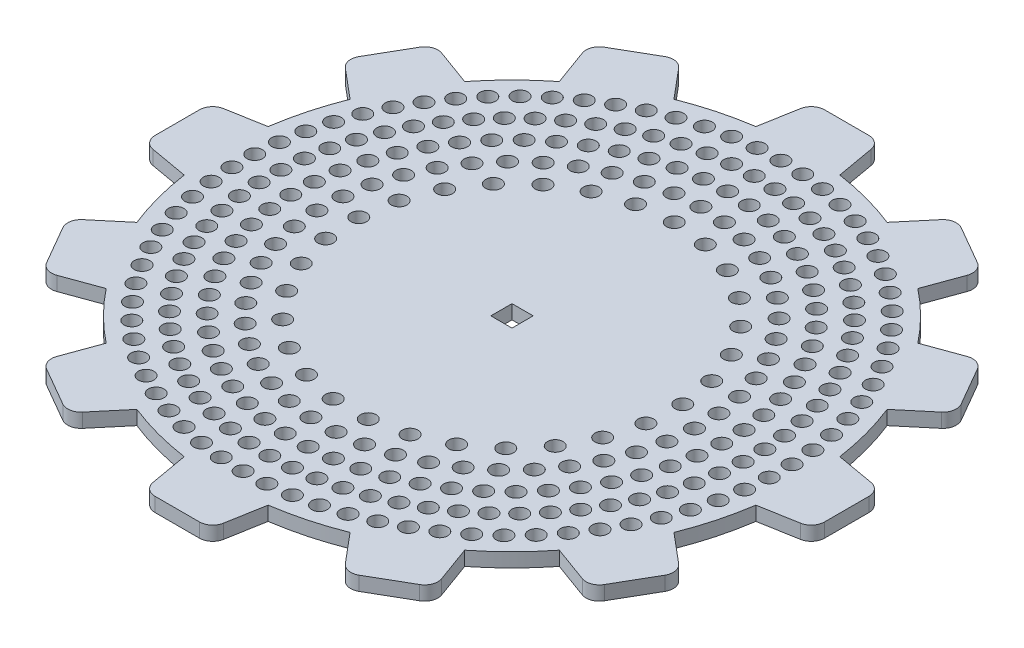
from build123d import *

# Parameters (mm, degrees)
SKETCH1_R           = 130
SKETCH1_R_2         = 3.5
SKETCH1_W           = 9.525
SKETCH1_H           = 9.525
BOSS_EXTRUDE1_DEPTH = 6.35
BOSS_EXTRUDE2_START = -6.35
BOSS_EXTRUDE2_DEPTH = 6.35
FILLET3_R           = 6
FILLET4_R           = 6


with BuildPart() as part:
    # Sketch1 → Boss-Extrude1 (new body)
    with BuildSketch(Plane(origin=(0, 0, 0), x_dir=(1, 0, 0), z_dir=(0, 1, 0))):
        with Locations(Location((0, 0, 0), (0, 0, 270))):
            Circle(SKETCH1_R)
        with Locations(Location((0, 85, 0), (0, 0, 270))):
            Circle(SKETCH1_R_2, mode=Mode.SUBTRACT)
        with Locations(Location((0, 97, 0), (0, 0, 270))):
            Circle(SKETCH1_R_2, mode=Mode.SUBTRACT)
        with Locations(Location((0, 109, 0), (0, 0, 270))):
            Circle(SKETCH1_R_2, mode=Mode.SUBTRACT)
        with Locations(Location((0, 121, 0), (0, 0, 270))):
            Circle(SKETCH1_R_2, mode=Mode.SUBTRACT)
        with Locations(Location((10.261516862, 120.564096114, 0), (0, 0, 270))):
            Circle(SKETCH1_R_2, mode=Mode.SUBTRACT)
        with Locations(Location((20.449099259, 119.259525152, 0), (0, 0, 270))):
            Circle(SKETCH1_R_2, mode=Mode.SUBTRACT)
        with Locations(Location((30.489345428, 117.095686579, 0), (0, 0, 270))):
            Circle(SKETCH1_R_2, mode=Mode.SUBTRACT)
        with Locations(Location((40.309915164, 114.088170901, 0), (0, 0, 270))):
            Circle(SKETCH1_R_2, mode=Mode.SUBTRACT)
        with Locations(Location((49.840051038, 110.258647337, 0), (0, 0, 270))):
            Circle(SKETCH1_R_2, mode=Mode.SUBTRACT)
        with Locations(Location((59.011088201, 105.634707693, 0), (0, 0, 270))):
            Circle(SKETCH1_R_2, mode=Mode.SUBTRACT)
        with Locations(Location((67.756949123, 100.249667559, 0), (0, 0, 270))):
            Circle(SKETCH1_R_2, mode=Mode.SUBTRACT)
        with Locations(Location((76.014619673, 94.142326273, 0), (0, 0, 270))):
            Circle(SKETCH1_R_2, mode=Mode.SUBTRACT)
        with Locations(Location((83.724603146, 87.356687369, 0), (0, 0, 270))):
            Circle(SKETCH1_R_2, mode=Mode.SUBTRACT)
        with Locations(Location((90.831348936, 79.94164153, 0), (0, 0, 270))):
            Circle(SKETCH1_R_2, mode=Mode.SUBTRACT)
        with Locations(Location((97.283652774, 71.950614333, 0), (0, 0, 270))):
            Circle(SKETCH1_R_2, mode=Mode.SUBTRACT)
        with Locations(Location((103.035025666, 63.44118131, 0), (0, 0, 270))):
            Circle(SKETCH1_R_2, mode=Mode.SUBTRACT)
        with Locations(Location((108.044028836, 54.474653123, 0), (0, 0, 270))):
            Circle(SKETCH1_R_2, mode=Mode.SUBTRACT)
        with Locations(Location((112.274572303, 45.115633811, 0), (0, 0, 270))):
            Circle(SKETCH1_R_2, mode=Mode.SUBTRACT)
        with Locations(Location((115.696174903, 35.431555324, 0), (0, 0, 270))):
            Circle(SKETCH1_R_2, mode=Mode.SUBTRACT)
        with Locations(Location((118.284183913, 25.492191669, 0), (0, 0, 270))):
            Circle(SKETCH1_R_2, mode=Mode.SUBTRACT)
        with Locations(Location((120.019952666, 15.369156189, 0), (0, 0, 270))):
            Circle(SKETCH1_R_2, mode=Mode.SUBTRACT)
        with Locations(Location((120.890974911, 5.135385587, 0), (0, 0, 270))):
            Circle(SKETCH1_R_2, mode=Mode.SUBTRACT)
        with Locations(Location((120.890974911, -5.135385587, 0), (0, 0, 270))):
            Circle(SKETCH1_R_2, mode=Mode.SUBTRACT)
        with Locations(Location((120.019952666, -15.369156189, 0), (0, 0, 270))):
            Circle(SKETCH1_R_2, mode=Mode.SUBTRACT)
        with Locations(Location((118.284183913, -25.492191669, 0), (0, 0, 270))):
            Circle(SKETCH1_R_2, mode=Mode.SUBTRACT)
        with Locations(Location((115.696174903, -35.431555324, 0), (0, 0, 270))):
            Circle(SKETCH1_R_2, mode=Mode.SUBTRACT)
        with Locations(Location((112.274572303, -45.115633811, 0), (0, 0, 270))):
            Circle(SKETCH1_R_2, mode=Mode.SUBTRACT)
        with Locations(Location((108.044028836, -54.474653123, 0), (0, 0, 270))):
            Circle(SKETCH1_R_2, mode=Mode.SUBTRACT)
        with Locations(Location((103.035025666, -63.44118131, 0), (0, 0, 270))):
            Circle(SKETCH1_R_2, mode=Mode.SUBTRACT)
        with Locations(Location((97.283652774, -71.950614333, 0), (0, 0, 270))):
            Circle(SKETCH1_R_2, mode=Mode.SUBTRACT)
        with Locations(Location((90.831348936, -79.94164153, 0), (0, 0, 270))):
            Circle(SKETCH1_R_2, mode=Mode.SUBTRACT)
        with Locations(Location((83.724603146, -87.356687368, 0), (0, 0, 270))):
            Circle(SKETCH1_R_2, mode=Mode.SUBTRACT)
        with Locations(Location((76.014619673, -94.142326273, 0), (0, 0, 270))):
            Circle(SKETCH1_R_2, mode=Mode.SUBTRACT)
        with Locations(Location((67.756949123, -100.249667558, 0), (0, 0, 270))):
            Circle(SKETCH1_R_2, mode=Mode.SUBTRACT)
        with Locations(Location((59.011088201, -105.634707692, 0), (0, 0, 270))):
            Circle(SKETCH1_R_2, mode=Mode.SUBTRACT)
        with Locations(Location((49.840051038, -110.258647337, 0), (0, 0, 270))):
            Circle(SKETCH1_R_2, mode=Mode.SUBTRACT)
        with Locations(Location((40.309915164, -114.088170901, 0), (0, 0, 270))):
            Circle(SKETCH1_R_2, mode=Mode.SUBTRACT)
        with Locations(Location((30.489345428, -117.095686579, 0), (0, 0, 270))):
            Circle(SKETCH1_R_2, mode=Mode.SUBTRACT)
        with Locations(Location((20.449099259, -119.259525152, 0), (0, 0, 270))):
            Circle(SKETCH1_R_2, mode=Mode.SUBTRACT)
        with Locations(Location((10.261516862, -120.564096114, 0), (0, 0, 270))):
            Circle(SKETCH1_R_2, mode=Mode.SUBTRACT)
        with Locations(Location((0, -121, 0), (0, 0, 270))):
            Circle(SKETCH1_R_2, mode=Mode.SUBTRACT)
        with Locations(Location((-10.261516862, -120.564096114, 0), (0, 0, 270))):
            Circle(SKETCH1_R_2, mode=Mode.SUBTRACT)
        with Locations(Location((-20.449099259, -119.259525152, 0), (0, 0, 270))):
            Circle(SKETCH1_R_2, mode=Mode.SUBTRACT)
        with Locations(Location((-30.489345428, -117.095686579, 0), (0, 0, 270))):
            Circle(SKETCH1_R_2, mode=Mode.SUBTRACT)
        with Locations(Location((-40.309915164, -114.088170901, 0), (0, 0, 270))):
            Circle(SKETCH1_R_2, mode=Mode.SUBTRACT)
        with Locations(Location((-49.840051038, -110.258647337, 0), (0, 0, 270))):
            Circle(SKETCH1_R_2, mode=Mode.SUBTRACT)
        with Locations(Location((-59.011088201, -105.634707693, 0), (0, 0, 270))):
            Circle(SKETCH1_R_2, mode=Mode.SUBTRACT)
        with Locations(Location((-67.756949123, -100.249667559, 0), (0, 0, 270))):
            Circle(SKETCH1_R_2, mode=Mode.SUBTRACT)
        with Locations(Location((-76.014619673, -94.142326273, 0), (0, 0, 270))):
            Circle(SKETCH1_R_2, mode=Mode.SUBTRACT)
        with Locations(Location((-83.724603146, -87.356687369, 0), (0, 0, 270))):
            Circle(SKETCH1_R_2, mode=Mode.SUBTRACT)
        with Locations(Location((-90.831348936, -79.94164153, 0), (0, 0, 270))):
            Circle(SKETCH1_R_2, mode=Mode.SUBTRACT)
        with Locations(Location((-97.283652774, -71.950614333, 0), (0, 0, 270))):
            Circle(SKETCH1_R_2, mode=Mode.SUBTRACT)
        with Locations(Location((-103.035025666, -63.44118131, 0), (0, 0, 270))):
            Circle(SKETCH1_R_2, mode=Mode.SUBTRACT)
        with Locations(Location((-108.044028836, -54.474653123, 0), (0, 0, 270))):
            Circle(SKETCH1_R_2, mode=Mode.SUBTRACT)
        with Locations(Location((-112.274572303, -45.115633811, 0), (0, 0, 270))):
            Circle(SKETCH1_R_2, mode=Mode.SUBTRACT)
        with Locations(Location((-115.696174903, -35.431555324, 0), (0, 0, 270))):
            Circle(SKETCH1_R_2, mode=Mode.SUBTRACT)
        with Locations(Location((-118.284183913, -25.492191669, 0), (0, 0, 270))):
            Circle(SKETCH1_R_2, mode=Mode.SUBTRACT)
        with Locations(Location((-120.019952666, -15.369156189, 0), (0, 0, 270))):
            Circle(SKETCH1_R_2, mode=Mode.SUBTRACT)
        with Locations(Location((-120.890974911, -5.135385587, 0), (0, 0, 270))):
            Circle(SKETCH1_R_2, mode=Mode.SUBTRACT)
        with Locations(Location((-120.890974911, 5.135385587, 0), (0, 0, 270))):
            Circle(SKETCH1_R_2, mode=Mode.SUBTRACT)
        with Locations(Location((-120.019952666, 15.369156189, 0), (0, 0, 270))):
            Circle(SKETCH1_R_2, mode=Mode.SUBTRACT)
        with Locations(Location((-118.284183913, 25.492191669, 0), (0, 0, 270))):
            Circle(SKETCH1_R_2, mode=Mode.SUBTRACT)
        with Locations(Location((-115.696174903, 35.431555324, 0), (0, 0, 270))):
            Circle(SKETCH1_R_2, mode=Mode.SUBTRACT)
        with Locations(Location((-112.274572303, 45.115633811, 0), (0, 0, 270))):
            Circle(SKETCH1_R_2, mode=Mode.SUBTRACT)
        with Locations(Location((-108.044028836, 54.474653123, 0), (0, 0, 270))):
            Circle(SKETCH1_R_2, mode=Mode.SUBTRACT)
        with Locations(Location((-103.035025666, 63.44118131, 0), (0, 0, 270))):
            Circle(SKETCH1_R_2, mode=Mode.SUBTRACT)
        with Locations(Location((-97.283652774, 71.950614333, 0), (0, 0, 270))):
            Circle(SKETCH1_R_2, mode=Mode.SUBTRACT)
        with Locations(Location((-90.831348936, 79.94164153, 0), (0, 0, 270))):
            Circle(SKETCH1_R_2, mode=Mode.SUBTRACT)
        with Locations(Location((-83.724603146, 87.356687368, 0), (0, 0, 270))):
            Circle(SKETCH1_R_2, mode=Mode.SUBTRACT)
        with Locations(Location((9.77068467, 108.561198045, 0), (0, 0, 270))):
            Circle(SKETCH1_R_2, mode=Mode.SUBTRACT)
        with Locations(Location((19.462701533, 107.248325157, 0), (0, 0, 270))):
            Circle(SKETCH1_R_2, mode=Mode.SUBTRACT)
        with Locations(Location((28.998016167, 105.071951816, 0), (0, 0, 270))):
            Circle(SKETCH1_R_2, mode=Mode.SUBTRACT)
        with Locations(Location((38.299855825, 102.0496009, 0), (0, 0, 270))):
            Circle(SKETCH1_R_2, mode=Mode.SUBTRACT)
        with Locations(Location((47.293327564, 98.205606601, 0), (0, 0, 270))):
            Circle(SKETCH1_R_2, mode=Mode.SUBTRACT)
        with Locations(Location((55.906021237, 93.570918503, 0), (0, 0, 270))):
            Circle(SKETCH1_R_2, mode=Mode.SUBTRACT)
        with Locations(Location((64.0685925, 88.182852387, 0), (0, 0, 270))):
            Circle(SKETCH1_R_2, mode=Mode.SUBTRACT)
        with Locations(Location((71.715321127, 82.084789794, 0), (0, 0, 270))):
            Circle(SKETCH1_R_2, mode=Mode.SUBTRACT)
        with Locations(Location((78.784640157, 75.32582874, 0), (0, 0, 270))):
            Circle(SKETCH1_R_2, mode=Mode.SUBTRACT)
        with Locations(Location((85.219631589, 67.960388403, 0), (0, 0, 270))):
            Circle(SKETCH1_R_2, mode=Mode.SUBTRACT)
        with Locations(Location((90.968484656, 60.047770978, 0), (0, 0, 270))):
            Circle(SKETCH1_R_2, mode=Mode.SUBTRACT)
        with Locations(Location((95.984912972, 51.65168421, 0), (0, 0, 270))):
            Circle(SKETCH1_R_2, mode=Mode.SUBTRACT)
        with Locations(Location((100.228527208, 42.83972845, 0), (0, 0, 270))):
            Circle(SKETCH1_R_2, mode=Mode.SUBTRACT)
        with Locations(Location((103.665160276, 33.682852387, 0), (0, 0, 270))):
            Circle(SKETCH1_R_2, mode=Mode.SUBTRACT)
        with Locations(Location((106.267142428, 24.254781801, 0), (0, 0, 270))):
            Circle(SKETCH1_R_2, mode=Mode.SUBTRACT)
        with Locations(Location((108.013524033, 14.631425974, 0), (0, 0, 270))):
            Circle(SKETCH1_R_2, mode=Mode.SUBTRACT)
        with Locations(Location((108.890244253, 4.890266508, 0), (0, 0, 270))):
            Circle(SKETCH1_R_2, mode=Mode.SUBTRACT)
        with Locations(Location((108.890244253, -4.890266508, 0), (0, 0, 270))):
            Circle(SKETCH1_R_2, mode=Mode.SUBTRACT)
        with Locations(Location((108.013524033, -14.631425974, 0), (0, 0, 270))):
            Circle(SKETCH1_R_2, mode=Mode.SUBTRACT)
        with Locations(Location((106.267142428, -24.254781801, 0), (0, 0, 270))):
            Circle(SKETCH1_R_2, mode=Mode.SUBTRACT)
        with Locations(Location((103.665160276, -33.682852387, 0), (0, 0, 270))):
            Circle(SKETCH1_R_2, mode=Mode.SUBTRACT)
        with Locations(Location((100.228527208, -42.83972845, 0), (0, 0, 270))):
            Circle(SKETCH1_R_2, mode=Mode.SUBTRACT)
        with Locations(Location((95.984912972, -51.65168421, 0), (0, 0, 270))):
            Circle(SKETCH1_R_2, mode=Mode.SUBTRACT)
        with Locations(Location((90.968484656, -60.047770978, 0), (0, 0, 270))):
            Circle(SKETCH1_R_2, mode=Mode.SUBTRACT)
        with Locations(Location((85.219631589, -67.960388403, 0), (0, 0, 270))):
            Circle(SKETCH1_R_2, mode=Mode.SUBTRACT)
        with Locations(Location((78.784640157, -75.32582874, 0), (0, 0, 270))):
            Circle(SKETCH1_R_2, mode=Mode.SUBTRACT)
        with Locations(Location((71.715321127, -82.084789794, 0), (0, 0, 270))):
            Circle(SKETCH1_R_2, mode=Mode.SUBTRACT)
        with Locations(Location((64.0685925, -88.182852387, 0), (0, 0, 270))):
            Circle(SKETCH1_R_2, mode=Mode.SUBTRACT)
        with Locations(Location((55.906021237, -93.570918503, 0), (0, 0, 270))):
            Circle(SKETCH1_R_2, mode=Mode.SUBTRACT)
        with Locations(Location((47.293327564, -98.205606601, 0), (0, 0, 270))):
            Circle(SKETCH1_R_2, mode=Mode.SUBTRACT)
        with Locations(Location((38.299855825, -102.0496009, 0), (0, 0, 270))):
            Circle(SKETCH1_R_2, mode=Mode.SUBTRACT)
        with Locations(Location((28.998016167, -105.071951816, 0), (0, 0, 270))):
            Circle(SKETCH1_R_2, mode=Mode.SUBTRACT)
        with Locations(Location((19.462701533, -107.248325157, 0), (0, 0, 270))):
            Circle(SKETCH1_R_2, mode=Mode.SUBTRACT)
        with Locations(Location((9.77068467, -108.561198045, 0), (0, 0, 270))):
            Circle(SKETCH1_R_2, mode=Mode.SUBTRACT)
        with Locations(Location((0, -109, 0), (0, 0, 270))):
            Circle(SKETCH1_R_2, mode=Mode.SUBTRACT)
        with Locations(Location((-9.77068467, -108.561198045, 0), (0, 0, 270))):
            Circle(SKETCH1_R_2, mode=Mode.SUBTRACT)
        with Locations(Location((-19.462701533, -107.248325157, 0), (0, 0, 270))):
            Circle(SKETCH1_R_2, mode=Mode.SUBTRACT)
        with Locations(Location((-28.998016167, -105.071951816, 0), (0, 0, 270))):
            Circle(SKETCH1_R_2, mode=Mode.SUBTRACT)
        with Locations(Location((-38.299855825, -102.0496009, 0), (0, 0, 270))):
            Circle(SKETCH1_R_2, mode=Mode.SUBTRACT)
        with Locations(Location((-47.293327564, -98.205606601, 0), (0, 0, 270))):
            Circle(SKETCH1_R_2, mode=Mode.SUBTRACT)
        with Locations(Location((-55.906021237, -93.570918503, 0), (0, 0, 270))):
            Circle(SKETCH1_R_2, mode=Mode.SUBTRACT)
        with Locations(Location((-64.0685925, -88.182852387, 0), (0, 0, 270))):
            Circle(SKETCH1_R_2, mode=Mode.SUBTRACT)
        with Locations(Location((-71.715321127, -82.084789794, 0), (0, 0, 270))):
            Circle(SKETCH1_R_2, mode=Mode.SUBTRACT)
        with Locations(Location((-78.784640157, -75.32582874, 0), (0, 0, 270))):
            Circle(SKETCH1_R_2, mode=Mode.SUBTRACT)
        with Locations(Location((-85.219631589, -67.960388403, 0), (0, 0, 270))):
            Circle(SKETCH1_R_2, mode=Mode.SUBTRACT)
        with Locations(Location((-90.968484656, -60.047770978, 0), (0, 0, 270))):
            Circle(SKETCH1_R_2, mode=Mode.SUBTRACT)
        with Locations(Location((-95.984912972, -51.65168421, 0), (0, 0, 270))):
            Circle(SKETCH1_R_2, mode=Mode.SUBTRACT)
        with Locations(Location((-100.228527208, -42.83972845, 0), (0, 0, 270))):
            Circle(SKETCH1_R_2, mode=Mode.SUBTRACT)
        with Locations(Location((-103.665160276, -33.682852387, 0), (0, 0, 270))):
            Circle(SKETCH1_R_2, mode=Mode.SUBTRACT)
        with Locations(Location((-106.267142428, -24.254781801, 0), (0, 0, 270))):
            Circle(SKETCH1_R_2, mode=Mode.SUBTRACT)
        with Locations(Location((-108.013524033, -14.631425974, 0), (0, 0, 270))):
            Circle(SKETCH1_R_2, mode=Mode.SUBTRACT)
        with Locations(Location((-108.890244253, -4.890266508, 0), (0, 0, 270))):
            Circle(SKETCH1_R_2, mode=Mode.SUBTRACT)
        with Locations(Location((-108.890244253, 4.890266508, 0), (0, 0, 270))):
            Circle(SKETCH1_R_2, mode=Mode.SUBTRACT)
        with Locations(Location((-108.013524033, 14.631425974, 0), (0, 0, 270))):
            Circle(SKETCH1_R_2, mode=Mode.SUBTRACT)
        with Locations(Location((10.310468108, 96.45047562, 0), (0, 0, 270))):
            Circle(SKETCH1_R_2, mode=Mode.SUBTRACT)
        with Locations(Location((20.504114492, 94.808128812, 0), (0, 0, 270))):
            Circle(SKETCH1_R_2, mode=Mode.SUBTRACT)
        with Locations(Location((30.465441066, 92.091568021, 0), (0, 0, 270))):
            Circle(SKETCH1_R_2, mode=Mode.SUBTRACT)
        with Locations(Location((40.08158202, 88.331572967, 0), (0, 0, 270))):
            Circle(SKETCH1_R_2, mode=Mode.SUBTRACT)
        with Locations(Location((49.243582633, 83.570745895, 0), (0, 0, 270))):
            Circle(SKETCH1_R_2, mode=Mode.SUBTRACT)
        with Locations(Location((57.847633778, 77.863028879, 0), (0, 0, 270))):
            Circle(SKETCH1_R_2, mode=Mode.SUBTRACT)
        with Locations(Location((65.796248118, 71.273092634, 0), (0, 0, 270))):
            Circle(SKETCH1_R_2, mode=Mode.SUBTRACT)
        with Locations(Location((72.999364676, 63.875603769, 0), (0, 0, 270))):
            Circle(SKETCH1_R_2, mode=Mode.SUBTRACT)
        with Locations(Location((79.375369263, 55.754378791, 0), (0, 0, 270))):
            Circle(SKETCH1_R_2, mode=Mode.SUBTRACT)
        with Locations(Location((84.8520192, 47.001434422, 0), (0, 0, 270))):
            Circle(SKETCH1_R_2, mode=Mode.SUBTRACT)
        with Locations(Location((89.367261853, 37.715945021, 0), (0, 0, 270))):
            Circle(SKETCH1_R_2, mode=Mode.SUBTRACT)
        with Locations(Location((92.869937721, 28.003118892, 0), (0, 0, 270))):
            Circle(SKETCH1_R_2, mode=Mode.SUBTRACT)
        with Locations(Location((95.320360085, 17.973006236, 0), (0, 0, 270))):
            Circle(SKETCH1_R_2, mode=Mode.SUBTRACT)
        with Locations(Location((96.690764682, 7.739252239, 0), (0, 0, 270))):
            Circle(SKETCH1_R_2, mode=Mode.SUBTRACT)
        with Locations(Location((96.965624279, -2.582190579, 0), (0, 0, 270))):
            Circle(SKETCH1_R_2, mode=Mode.SUBTRACT)
        with Locations(Location((96.141824607, -12.874376147, 0), (0, 0, 270))):
            Circle(SKETCH1_R_2, mode=Mode.SUBTRACT)
        with Locations(Location((94.228699647, -23.020689887, 0), (0, 0, 270))):
            Circle(SKETCH1_R_2, mode=Mode.SUBTRACT)
        with Locations(Location((91.247925867, -32.906170013, 0), (0, 0, 270))):
            Circle(SKETCH1_R_2, mode=Mode.SUBTRACT)
        with Locations(Location((87.233276627, -42.418810085, 0), (0, 0, 270))):
            Circle(SKETCH1_R_2, mode=Mode.SUBTRACT)
        with Locations(Location((82.230239505, -51.450828088, 0), (0, 0, 270))):
            Circle(SKETCH1_R_2, mode=Mode.SUBTRACT)
        with Locations(Location((76.295500913, -59.89988765, 0), (0, 0, 270))):
            Circle(SKETCH1_R_2, mode=Mode.SUBTRACT)
        with Locations(Location((69.496303809, -67.67025755, 0), (0, 0, 270))):
            Circle(SKETCH1_R_2, mode=Mode.SUBTRACT)
        with Locations(Location((61.909685814, -74.673896393, 0), (0, 0, 270))):
            Circle(SKETCH1_R_2, mode=Mode.SUBTRACT)
        with Locations(Location((53.62160634, -80.831450151, 0), (0, 0, 270))):
            Circle(SKETCH1_R_2, mode=Mode.SUBTRACT)
        with Locations(Location((44.725972641, -86.07315128, 0), (0, 0, 270))):
            Circle(SKETCH1_R_2, mode=Mode.SUBTRACT)
        with Locations(Location((35.3235758, -90.339609213, 0), (0, 0, 270))):
            Circle(SKETCH1_R_2, mode=Mode.SUBTRACT)
        with Locations(Location((25.52094873, -93.582483275, 0), (0, 0, 270))):
            Circle(SKETCH1_R_2, mode=Mode.SUBTRACT)
        with Locations(Location((15.429159114, -95.765030408, 0), (0, 0, 270))):
            Circle(SKETCH1_R_2, mode=Mode.SUBTRACT)
        with Locations(Location((5.16255096, -96.862521481, 0), (0, 0, 270))):
            Circle(SKETCH1_R_2, mode=Mode.SUBTRACT)
        with Locations(Location((-5.16255096, -96.862521481, 0), (0, 0, 270))):
            Circle(SKETCH1_R_2, mode=Mode.SUBTRACT)
        with Locations(Location((-15.429159114, -95.765030408, 0), (0, 0, 270))):
            Circle(SKETCH1_R_2, mode=Mode.SUBTRACT)
        with Locations(Location((-25.52094873, -93.582483275, 0), (0, 0, 270))):
            Circle(SKETCH1_R_2, mode=Mode.SUBTRACT)
        with Locations(Location((-35.3235758, -90.339609213, 0), (0, 0, 270))):
            Circle(SKETCH1_R_2, mode=Mode.SUBTRACT)
        with Locations(Location((-44.725972641, -86.07315128, 0), (0, 0, 270))):
            Circle(SKETCH1_R_2, mode=Mode.SUBTRACT)
        with Locations(Location((-53.62160634, -80.831450151, 0), (0, 0, 270))):
            Circle(SKETCH1_R_2, mode=Mode.SUBTRACT)
        with Locations(Location((-61.909685814, -74.673896393, 0), (0, 0, 270))):
            Circle(SKETCH1_R_2, mode=Mode.SUBTRACT)
        with Locations(Location((-69.496303809, -67.67025755, 0), (0, 0, 270))):
            Circle(SKETCH1_R_2, mode=Mode.SUBTRACT)
        with Locations(Location((-76.295500913, -59.89988765, 0), (0, 0, 270))):
            Circle(SKETCH1_R_2, mode=Mode.SUBTRACT)
        with Locations(Location((-82.230239505, -51.450828088, 0), (0, 0, 270))):
            Circle(SKETCH1_R_2, mode=Mode.SUBTRACT)
        with Locations(Location((-87.233276627, -42.418810085, 0), (0, 0, 270))):
            Circle(SKETCH1_R_2, mode=Mode.SUBTRACT)
        with Locations(Location((-91.247925867, -32.906170013, 0), (0, 0, 270))):
            Circle(SKETCH1_R_2, mode=Mode.SUBTRACT)
        with Locations(Location((-94.228699647, -23.020689888, 0), (0, 0, 270))):
            Circle(SKETCH1_R_2, mode=Mode.SUBTRACT)
        with Locations(Location((-96.141824607, -12.874376147, 0), (0, 0, 270))):
            Circle(SKETCH1_R_2, mode=Mode.SUBTRACT)
        with Locations(Location((-96.965624279, -2.582190579, 0), (0, 0, 270))):
            Circle(SKETCH1_R_2, mode=Mode.SUBTRACT)
        with Locations(Location((-96.690764682, 7.739252239, 0), (0, 0, 270))):
            Circle(SKETCH1_R_2, mode=Mode.SUBTRACT)
        with Locations(Location((-95.320360085, 17.973006236, 0), (0, 0, 270))):
            Circle(SKETCH1_R_2, mode=Mode.SUBTRACT)
        with Locations(Location((-92.869937721, 28.003118892, 0), (0, 0, 270))):
            Circle(SKETCH1_R_2, mode=Mode.SUBTRACT)
        with Locations(Location((-89.367261853, 37.715945021, 0), (0, 0, 270))):
            Circle(SKETCH1_R_2, mode=Mode.SUBTRACT)
        with Locations(Location((-84.8520192, 47.001434422, 0), (0, 0, 270))):
            Circle(SKETCH1_R_2, mode=Mode.SUBTRACT)
        with Locations(Location((-79.375369263, 55.754378791, 0), (0, 0, 270))):
            Circle(SKETCH1_R_2, mode=Mode.SUBTRACT)
        with Locations(Location((-72.999364676, 63.875603769, 0), (0, 0, 270))):
            Circle(SKETCH1_R_2, mode=Mode.SUBTRACT)
        with Locations(Location((11.329391207, 84.241586493, 0), (0, 0, 270))):
            Circle(SKETCH1_R_2, mode=Mode.SUBTRACT)
        with Locations(Location((22.456609159, 81.97987988, 0), (0, 0, 270))):
            Circle(SKETCH1_R_2, mode=Mode.SUBTRACT)
        with Locations(Location((33.183088389, 78.255240367, 0), (0, 0, 270))):
            Circle(SKETCH1_R_2, mode=Mode.SUBTRACT)
        with Locations(Location((43.31741462, 73.134134237, 0), (0, 0, 270))):
            Circle(SKETCH1_R_2, mode=Mode.SUBTRACT)
        with Locations(Location((52.678740562, 66.707947749, 0), (0, 0, 270))):
            Circle(SKETCH1_R_2, mode=Mode.SUBTRACT)
        with Locations(Location((61.10001313, 59.091356352, 0), (0, 0, 270))):
            Circle(SKETCH1_R_2, mode=Mode.SUBTRACT)
        with Locations(Location((68.430954516, 50.420278302, 0), (0, 0, 270))):
            Circle(SKETCH1_R_2, mode=Mode.SUBTRACT)
        with Locations(Location((74.540743898, 40.849449191, 0), (0, 0, 270))):
            Circle(SKETCH1_R_2, mode=Mode.SUBTRACT)
        with Locations(Location((79.320351939, 30.549660691, 0), (0, 0, 270))):
            Circle(SKETCH1_R_2, mode=Mode.SUBTRACT)
        with Locations(Location((82.68448642, 19.704712773, 0), (0, 0, 270))):
            Circle(SKETCH1_R_2, mode=Mode.SUBTRACT)
        with Locations(Location((84.573114283, 8.508133788, 0), (0, 0, 270))):
            Circle(SKETCH1_R_2, mode=Mode.SUBTRACT)
        with Locations(Location((84.952532917, -2.840273046, 0), (0, 0, 270))):
            Circle(SKETCH1_R_2, mode=Mode.SUBTRACT)
        with Locations(Location((83.815971589, -14.13799514, 0), (0, 0, 270))):
            Circle(SKETCH1_R_2, mode=Mode.SUBTRACT)
        with Locations(Location((81.183712263, -25.183424375, 0), (0, 0, 270))):
            Circle(SKETCH1_R_2, mode=Mode.SUBTRACT)
        with Locations(Location((77.102727667, -35.779454806, 0), (0, 0, 270))):
            Circle(SKETCH1_R_2, mode=Mode.SUBTRACT)
        with Locations(Location((71.64584307, -45.737000019, 0), (0, 0, 270))):
            Circle(SKETCH1_R_2, mode=Mode.SUBTRACT)
        with Locations(Location((64.910436707, -54.878367382, 0), (0, 0, 270))):
            Circle(SKETCH1_R_2, mode=Mode.SUBTRACT)
        with Locations(Location((57.016702062, -63.04042898, 0), (0, 0, 270))):
            Circle(SKETCH1_R_2, mode=Mode.SUBTRACT)
        with Locations(Location((48.105503018, -70.077532629, 0), (0, 0, 270))):
            Circle(SKETCH1_R_2, mode=Mode.SUBTRACT)
        with Locations(Location((38.335860133, -75.864101048, 0), (0, 0, 270))):
            Circle(SKETCH1_R_2, mode=Mode.SUBTRACT)
        with Locations(Location((27.882112916, -80.296872787, 0), (0, 0, 270))):
            Circle(SKETCH1_R_2, mode=Mode.SUBTRACT)
        with Locations(Location((16.930808734, -83.296744928, 0), (0, 0, 270))):
            Circle(SKETCH1_R_2, mode=Mode.SUBTRACT)
        with Locations(Location((5.677373868, -84.810184683, 0), (0, 0, 270))):
            Circle(SKETCH1_R_2, mode=Mode.SUBTRACT)
        with Locations(Location((-5.677373868, -84.810184683, 0), (0, 0, 270))):
            Circle(SKETCH1_R_2, mode=Mode.SUBTRACT)
        with Locations(Location((-16.930808734, -83.296744928, 0), (0, 0, 270))):
            Circle(SKETCH1_R_2, mode=Mode.SUBTRACT)
        with Locations(Location((-27.882112916, -80.296872787, 0), (0, 0, 270))):
            Circle(SKETCH1_R_2, mode=Mode.SUBTRACT)
        with Locations(Location((-38.335860133, -75.864101048, 0), (0, 0, 270))):
            Circle(SKETCH1_R_2, mode=Mode.SUBTRACT)
        with Locations(Location((-48.105503018, -70.077532629, 0), (0, 0, 270))):
            Circle(SKETCH1_R_2, mode=Mode.SUBTRACT)
        with Locations(Location((-57.016702062, -63.04042898, 0), (0, 0, 270))):
            Circle(SKETCH1_R_2, mode=Mode.SUBTRACT)
        with Locations(Location((-64.910436707, -54.878367383, 0), (0, 0, 270))):
            Circle(SKETCH1_R_2, mode=Mode.SUBTRACT)
        with Locations(Location((-71.64584307, -45.737000019, 0), (0, 0, 270))):
            Circle(SKETCH1_R_2, mode=Mode.SUBTRACT)
        with Locations(Location((-77.102727667, -35.779454806, 0), (0, 0, 270))):
            Circle(SKETCH1_R_2, mode=Mode.SUBTRACT)
        with Locations(Location((-81.183712263, -25.183424375, 0), (0, 0, 270))):
            Circle(SKETCH1_R_2, mode=Mode.SUBTRACT)
        with Locations(Location((-83.815971589, -14.13799514, 0), (0, 0, 270))):
            Circle(SKETCH1_R_2, mode=Mode.SUBTRACT)
        with Locations(Location((-84.952532917, -2.840273046, 0), (0, 0, 270))):
            Circle(SKETCH1_R_2, mode=Mode.SUBTRACT)
        with Locations(Location((-84.573114283, 8.508133788, 0), (0, 0, 270))):
            Circle(SKETCH1_R_2, mode=Mode.SUBTRACT)
        with Locations(Location((-82.68448642, 19.704712773, 0), (0, 0, 270))):
            Circle(SKETCH1_R_2, mode=Mode.SUBTRACT)
        with Locations(Location((-79.320351939, 30.549660691, 0), (0, 0, 270))):
            Circle(SKETCH1_R_2, mode=Mode.SUBTRACT)
        with Locations(Location((-74.540743898, 40.849449191, 0), (0, 0, 270))):
            Circle(SKETCH1_R_2, mode=Mode.SUBTRACT)
        with Locations(Location((-68.430954516, 50.420278302, 0), (0, 0, 270))):
            Circle(SKETCH1_R_2, mode=Mode.SUBTRACT)
        with Locations(Location((-61.10001313, 59.091356352, 0), (0, 0, 270))):
            Circle(SKETCH1_R_2, mode=Mode.SUBTRACT)
        with Locations(Location((-52.678740562, 66.707947749, 0), (0, 0, 270))):
            Circle(SKETCH1_R_2, mode=Mode.SUBTRACT)
        with Locations(Location((-43.31741462, 73.134134237, 0), (0, 0, 270))):
            Circle(SKETCH1_R_2, mode=Mode.SUBTRACT)
        with Locations(Location((-33.183088389, 78.255240367, 0), (0, 0, 270))):
            Circle(SKETCH1_R_2, mode=Mode.SUBTRACT)
        with Locations(Location((-22.456609159, 81.97987988, 0), (0, 0, 270))):
            Circle(SKETCH1_R_2, mode=Mode.SUBTRACT)
        with Locations(Location((-11.329391207, 84.241586493, 0), (0, 0, 270))):
            Circle(SKETCH1_R_2, mode=Mode.SUBTRACT)
        with Locations(Location((-65.796248118, 71.273092634, 0), (0, 0, 270))):
            Circle(SKETCH1_R_2, mode=Mode.SUBTRACT)
        with Locations(Location((-57.847633778, 77.863028879, 0), (0, 0, 270))):
            Circle(SKETCH1_R_2, mode=Mode.SUBTRACT)
        with Locations(Location((-49.243582633, 83.570745895, 0), (0, 0, 270))):
            Circle(SKETCH1_R_2, mode=Mode.SUBTRACT)
        with Locations(Location((-40.08158202, 88.331572967, 0), (0, 0, 270))):
            Circle(SKETCH1_R_2, mode=Mode.SUBTRACT)
        with Locations(Location((-30.465441066, 92.091568021, 0), (0, 0, 270))):
            Circle(SKETCH1_R_2, mode=Mode.SUBTRACT)
        with Locations(Location((-20.504114492, 94.808128812, 0), (0, 0, 270))):
            Circle(SKETCH1_R_2, mode=Mode.SUBTRACT)
        with Locations(Location((-10.310468108, 96.45047562, 0), (0, 0, 270))):
            Circle(SKETCH1_R_2, mode=Mode.SUBTRACT)
        with Locations(Location((-106.267142428, 24.254781801, 0), (0, 0, 270))):
            Circle(SKETCH1_R_2, mode=Mode.SUBTRACT)
        with Locations(Location((-103.665160276, 33.682852387, 0), (0, 0, 270))):
            Circle(SKETCH1_R_2, mode=Mode.SUBTRACT)
        with Locations(Location((-100.228527208, 42.83972845, 0), (0, 0, 270))):
            Circle(SKETCH1_R_2, mode=Mode.SUBTRACT)
        with Locations(Location((-95.984912972, 51.65168421, 0), (0, 0, 270))):
            Circle(SKETCH1_R_2, mode=Mode.SUBTRACT)
        with Locations(Location((-90.968484656, 60.047770978, 0), (0, 0, 270))):
            Circle(SKETCH1_R_2, mode=Mode.SUBTRACT)
        with Locations(Location((-85.219631589, 67.960388403, 0), (0, 0, 270))):
            Circle(SKETCH1_R_2, mode=Mode.SUBTRACT)
        with Locations(Location((-78.784640157, 75.32582874, 0), (0, 0, 270))):
            Circle(SKETCH1_R_2, mode=Mode.SUBTRACT)
        with Locations(Location((-71.715321127, 82.084789794, 0), (0, 0, 270))):
            Circle(SKETCH1_R_2, mode=Mode.SUBTRACT)
        with Locations(Location((-64.0685925, 88.182852387, 0), (0, 0, 270))):
            Circle(SKETCH1_R_2, mode=Mode.SUBTRACT)
        with Locations(Location((-55.906021237, 93.570918503, 0), (0, 0, 270))):
            Circle(SKETCH1_R_2, mode=Mode.SUBTRACT)
        with Locations(Location((-47.293327564, 98.205606601, 0), (0, 0, 270))):
            Circle(SKETCH1_R_2, mode=Mode.SUBTRACT)
        with Locations(Location((-38.299855825, 102.0496009, 0), (0, 0, 270))):
            Circle(SKETCH1_R_2, mode=Mode.SUBTRACT)
        with Locations(Location((-28.998016167, 105.071951816, 0), (0, 0, 270))):
            Circle(SKETCH1_R_2, mode=Mode.SUBTRACT)
        with Locations(Location((-19.462701533, 107.248325157, 0), (0, 0, 270))):
            Circle(SKETCH1_R_2, mode=Mode.SUBTRACT)
        with Locations(Location((-9.77068467, 108.561198045, 0), (0, 0, 270))):
            Circle(SKETCH1_R_2, mode=Mode.SUBTRACT)
        with Locations(Location((-76.014619673, 94.142326273, 0), (0, 0, 270))):
            Circle(SKETCH1_R_2, mode=Mode.SUBTRACT)
        with Locations(Location((-67.756949123, 100.249667558, 0), (0, 0, 270))):
            Circle(SKETCH1_R_2, mode=Mode.SUBTRACT)
        with Locations(Location((-59.011088201, 105.634707692, 0), (0, 0, 270))):
            Circle(SKETCH1_R_2, mode=Mode.SUBTRACT)
        with Locations(Location((-49.840051038, 110.258647337, 0), (0, 0, 270))):
            Circle(SKETCH1_R_2, mode=Mode.SUBTRACT)
        with Locations(Location((-40.309915164, 114.088170901, 0), (0, 0, 270))):
            Circle(SKETCH1_R_2, mode=Mode.SUBTRACT)
        with Locations(Location((-30.489345428, 117.095686579, 0), (0, 0, 270))):
            Circle(SKETCH1_R_2, mode=Mode.SUBTRACT)
        with Locations(Location((-20.449099259, 119.259525152, 0), (0, 0, 270))):
            Circle(SKETCH1_R_2, mode=Mode.SUBTRACT)
        with Locations(Location((-10.261516862, 120.564096114, 0), (0, 0, 270))):
            Circle(SKETCH1_R_2, mode=Mode.SUBTRACT)
        with Locations(Location((0, 73, 0), (0, 0, 270))):
            Circle(SKETCH1_R_2, mode=Mode.SUBTRACT)
        with Locations(Location((15.692842135, 71.293300567, 0), (0, 0, 270))):
            Circle(SKETCH1_R_2, mode=Mode.SUBTRACT)
        with Locations(Location((30.651904414, 66.253005636, 0), (0, 0, 270))):
            Circle(SKETCH1_R_2, mode=Mode.SUBTRACT)
        with Locations(Location((44.177717709, 58.114793797, 0), (0, 0, 270))):
            Circle(SKETCH1_R_2, mode=Mode.SUBTRACT)
        with Locations(Location((55.637830024, 47.259198789, 0), (0, 0, 270))):
            Circle(SKETCH1_R_2, mode=Mode.SUBTRACT)
        with Locations(Location((64.496379245, 34.193816171, 0), (0, 0, 270))):
            Circle(SKETCH1_R_2, mode=Mode.SUBTRACT)
        with Locations(Location((70.339149454, 19.529568713, 0), (0, 0, 270))):
            Circle(SKETCH1_R_2, mode=Mode.SUBTRACT)
        with Locations(Location((72.892939211, 3.952140327, 0), (0, 0, 270))):
            Circle(SKETCH1_R_2, mode=Mode.SUBTRACT)
        with Locations(Location((72.038336146, -11.810085748, 0), (0, 0, 270))):
            Circle(SKETCH1_R_2, mode=Mode.SUBTRACT)
        with Locations(Location((67.815300547, -27.02008534, 0), (0, 0, 270))):
            Circle(SKETCH1_R_2, mode=Mode.SUBTRACT)
        with Locations(Location((60.421296865, -40.966655771, 0), (0, 0, 270))):
            Circle(SKETCH1_R_2, mode=Mode.SUBTRACT)
        with Locations(Location((50.202060496, -52.99767091, 0), (0, 0, 270))):
            Circle(SKETCH1_R_2, mode=Mode.SUBTRACT)
        with Locations(Location((37.635431574, -62.55057386, 0), (0, 0, 270))):
            Circle(SKETCH1_R_2, mode=Mode.SUBTRACT)
        with Locations(Location((23.3090117, -69.178681496, 0), (0, 0, 270))):
            Circle(SKETCH1_R_2, mode=Mode.SUBTRACT)
        with Locations(Location((7.892688345, -72.572070872, 0), (0, 0, 270))):
            Circle(SKETCH1_R_2, mode=Mode.SUBTRACT)
        with Locations(Location((-7.892688345, -72.572070872, 0), (0, 0, 270))):
            Circle(SKETCH1_R_2, mode=Mode.SUBTRACT)
        with Locations(Location((-23.3090117, -69.178681496, 0), (0, 0, 270))):
            Circle(SKETCH1_R_2, mode=Mode.SUBTRACT)
        with Locations(Location((-37.635431574, -62.55057386, 0), (0, 0, 270))):
            Circle(SKETCH1_R_2, mode=Mode.SUBTRACT)
        with Locations(Location((-50.202060496, -52.99767091, 0), (0, 0, 270))):
            Circle(SKETCH1_R_2, mode=Mode.SUBTRACT)
        with Locations(Location((-60.421296865, -40.966655771, 0), (0, 0, 270))):
            Circle(SKETCH1_R_2, mode=Mode.SUBTRACT)
        with Locations(Location((-67.815300547, -27.02008534, 0), (0, 0, 270))):
            Circle(SKETCH1_R_2, mode=Mode.SUBTRACT)
        with Locations(Location((-72.038336146, -11.810085748, 0), (0, 0, 270))):
            Circle(SKETCH1_R_2, mode=Mode.SUBTRACT)
        with Locations(Location((-72.892939211, 3.952140327, 0), (0, 0, 270))):
            Circle(SKETCH1_R_2, mode=Mode.SUBTRACT)
        with Locations(Location((-70.339149454, 19.529568713, 0), (0, 0, 270))):
            Circle(SKETCH1_R_2, mode=Mode.SUBTRACT)
        with Locations(Location((-64.496379245, 34.193816171, 0), (0, 0, 270))):
            Circle(SKETCH1_R_2, mode=Mode.SUBTRACT)
        with Locations(Location((-55.637830024, 47.259198789, 0), (0, 0, 270))):
            Circle(SKETCH1_R_2, mode=Mode.SUBTRACT)
        with Locations(Location((-44.177717709, 58.114793797, 0), (0, 0, 270))):
            Circle(SKETCH1_R_2, mode=Mode.SUBTRACT)
        with Locations(Location((-30.651904414, 66.253005636, 0), (0, 0, 270))):
            Circle(SKETCH1_R_2, mode=Mode.SUBTRACT)
        with Locations(Location((-15.692842135, 71.293300567, 0), (0, 0, 270))):
            Circle(SKETCH1_R_2, mode=Mode.SUBTRACT)
        Rectangle(SKETCH1_W, SKETCH1_H, mode=Mode.SUBTRACT)
    extrude(amount=BOSS_EXTRUDE1_DEPTH)

    # Sketch2 → Boss-Extrude2 (add)
    with BuildSketch(Plane(origin=(0, 6.35, 0), x_dir=(1, 0, 0), z_dir=(0, 1, 0)).offset(BOSS_EXTRUDE2_START)):
        with BuildLine():
            Line((0, 150.621833488), (15, 150.621833488))
            Line((15, 150.621833488), (18.879193576, 128.621833488))
            ThreePointArc((18.879193576, 128.621833488), (0, 130), (-18.879193576, 128.621833488))
            Line((-18.879193576, 128.621833488), (-15, 150.621833488))
            Line((-15, 150.621833488), (0, 150.621833488))
        make_face()
        with BuildLine():
            Line((62.320535687, 137.942334166), (47.961055505, 120.82937207))
            ThreePointArc((47.961055505, 120.82937207), (65, 112.583302492), (80.660777984, 101.950178495))
            Line((80.660777984, 101.950178495), (88.301297801, 122.942334166))
            Line((88.301297801, 122.942334166), (75.310916744, 130.442334166))
            Line((75.310916744, 130.442334166), (62.320535687, 137.942334166))
        make_face()
        with BuildLine():
            Line((122.942334166, 88.301297801), (101.950178495, 80.660777984))
            ThreePointArc((101.950178495, 80.660777984), (112.583302492, 65), (120.82937207, 47.961055505))
            Line((120.82937207, 47.961055505), (137.942334166, 62.320535687))
            Line((137.942334166, 62.320535687), (130.442334166, 75.310916744))
            Line((130.442334166, 75.310916744), (122.942334166, 88.301297801))
        make_face()
        with BuildLine():
            Line((150.621833488, 15), (128.621833488, 18.879193576))
            ThreePointArc((128.621833488, 18.879193576), (130, 0), (128.621833488, -18.879193576))
            Line((128.621833488, -18.879193576), (150.621833488, -15))
            Line((150.621833488, -15), (150.621833488, 0))
            Line((150.621833488, 0), (150.621833488, 15))
        make_face()
        with BuildLine():
            Line((137.942334166, -62.320535687), (120.82937207, -47.961055505))
            ThreePointArc((120.82937207, -47.961055505), (112.583302492, -65), (101.950178495, -80.660777984))
            Line((101.950178495, -80.660777984), (122.942334166, -88.301297801))
            Line((122.942334166, -88.301297801), (130.442334166, -75.310916744))
            Line((130.442334166, -75.310916744), (137.942334166, -62.320535687))
        make_face()
        with BuildLine():
            Line((88.301297801, -122.942334166), (80.660777984, -101.950178495))
            ThreePointArc((80.660777984, -101.950178495), (65, -112.583302492), (47.961055505, -120.82937207))
            Line((47.961055505, -120.82937207), (62.320535687, -137.942334166))
            Line((62.320535687, -137.942334166), (75.310916744, -130.442334166))
            Line((75.310916744, -130.442334166), (88.301297801, -122.942334166))
        make_face()
        with BuildLine():
            Line((15, -150.621833488), (18.879193576, -128.621833488))
            ThreePointArc((18.879193576, -128.621833488), (0, -130), (-18.879193576, -128.621833488))
            Line((-18.879193576, -128.621833488), (-15, -150.621833488))
            Line((-15, -150.621833488), (0, -150.621833488))
            Line((0, -150.621833488), (15, -150.621833488))
        make_face()
        with BuildLine():
            Line((-62.320535687, -137.942334166), (-47.961055505, -120.82937207))
            ThreePointArc((-47.961055505, -120.82937207), (-65, -112.583302492), (-80.660777984, -101.950178495))
            Line((-80.660777984, -101.950178495), (-88.301297801, -122.942334166))
            Line((-88.301297801, -122.942334166), (-75.310916744, -130.442334166))
            Line((-75.310916744, -130.442334166), (-62.320535687, -137.942334166))
        make_face()
        with BuildLine():
            Line((-122.942334166, -88.301297801), (-101.950178495, -80.660777984))
            ThreePointArc((-101.950178495, -80.660777984), (-112.583302492, -65), (-120.82937207, -47.961055505))
            Line((-120.82937207, -47.961055505), (-137.942334166, -62.320535687))
            Line((-137.942334166, -62.320535687), (-130.442334166, -75.310916744))
            Line((-130.442334166, -75.310916744), (-122.942334166, -88.301297801))
        make_face()
        with BuildLine():
            Line((-150.621833488, -15), (-128.621833488, -18.879193576))
            ThreePointArc((-128.621833488, -18.879193576), (-130, 0), (-128.621833488, 18.879193576))
            Line((-128.621833488, 18.879193576), (-150.621833488, 15))
            Line((-150.621833488, 15), (-150.621833488, 0))
            Line((-150.621833488, 0), (-150.621833488, -15))
        make_face()
        with BuildLine():
            Line((-137.942334166, 62.320535687), (-120.82937207, 47.961055505))
            ThreePointArc((-120.82937207, 47.961055505), (-112.583302492, 65), (-101.950178495, 80.660777984))
            Line((-101.950178495, 80.660777984), (-122.942334166, 88.301297801))
            Line((-122.942334166, 88.301297801), (-130.442334166, 75.310916744))
            Line((-130.442334166, 75.310916744), (-137.942334166, 62.320535687))
        make_face()
        with BuildLine():
            Line((-88.301297801, 122.942334166), (-80.660777984, 101.950178495))
            ThreePointArc((-80.660777984, 101.950178495), (-65, 112.583302492), (-47.961055505, 120.82937207))
            Line((-47.961055505, 120.82937207), (-62.320535687, 137.942334166))
            Line((-62.320535687, 137.942334166), (-75.310916744, 130.442334166))
            Line((-75.310916744, 130.442334166), (-88.301297801, 122.942334166))
        make_face()
    extrude(amount=BOSS_EXTRUDE2_DEPTH)

    # Fillet3
    fillet3_edges = [part.edges().sort_by_distance(p)[0] for p in [
        (-15, 3.175, -150.621833488),
        (15, 3.175, -150.621833488),
        (62.320535687, 3.175, -137.942334166),
        (88.301297801, 3.175, -122.942334166),
        (137.942334166, 3.175, -62.320535687),
        (150.621833488, 3.175, -15),
        (150.621833488, 3.175, 15),
        (137.942334166, 3.175, 62.320535687),
        (122.942334166, 3.175, 88.301297801),
        (88.301297801, 3.175, 122.942334166),
        (62.320535687, 3.175, 137.942334166),
        (15, 3.175, 150.621833488),
        (-15, 3.175, 150.621833488),
        (-62.320535687, 3.175, 137.942334166),
        (-88.301297801, 3.175, 122.942334166),
        (-122.942334166, 3.175, 88.301297801),
        (-137.942334166, 3.175, 62.320535687),
        (-150.621833488, 3.175, 15),
        (-150.621833488, 3.175, -15),
        (-137.942334166, 3.175, -62.320535687),
        (-122.942334166, 3.175, -88.301297801),
        (-88.301297801, 3.175, -122.942334166),
        (-62.320535687, 3.175, -137.942334166),
    ]]
    fillet(fillet3_edges, radius=FILLET3_R)

    # Fillet4
    fillet4_edges = [part.edges().sort_by_distance(p)[0] for p in [
        (122.942334166, 3.175, -88.301297801),
    ]]
    fillet(fillet4_edges, radius=FILLET4_R)


solid = part.part
